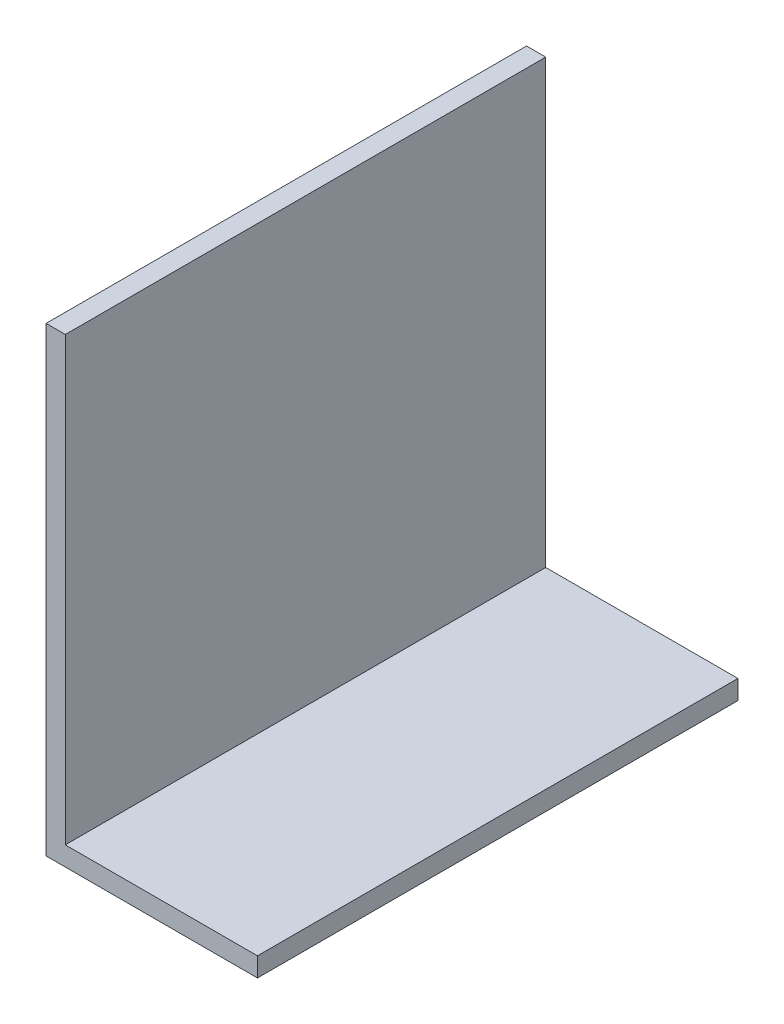
from build123d import *

# Parameters (mm, degrees)
BOSS_EXTRUDE1_DEPTH = 75


with BuildPart() as part:
    # Sketch1 → Boss-Extrude1 (new body)
    with BuildSketch(Plane.XY):
        Polygon((0, 72), (3, 72), (3, 3), (33, 3), (33, 0), (0, 0), align=None)
    extrude(amount=BOSS_EXTRUDE1_DEPTH)


solid = part.part
